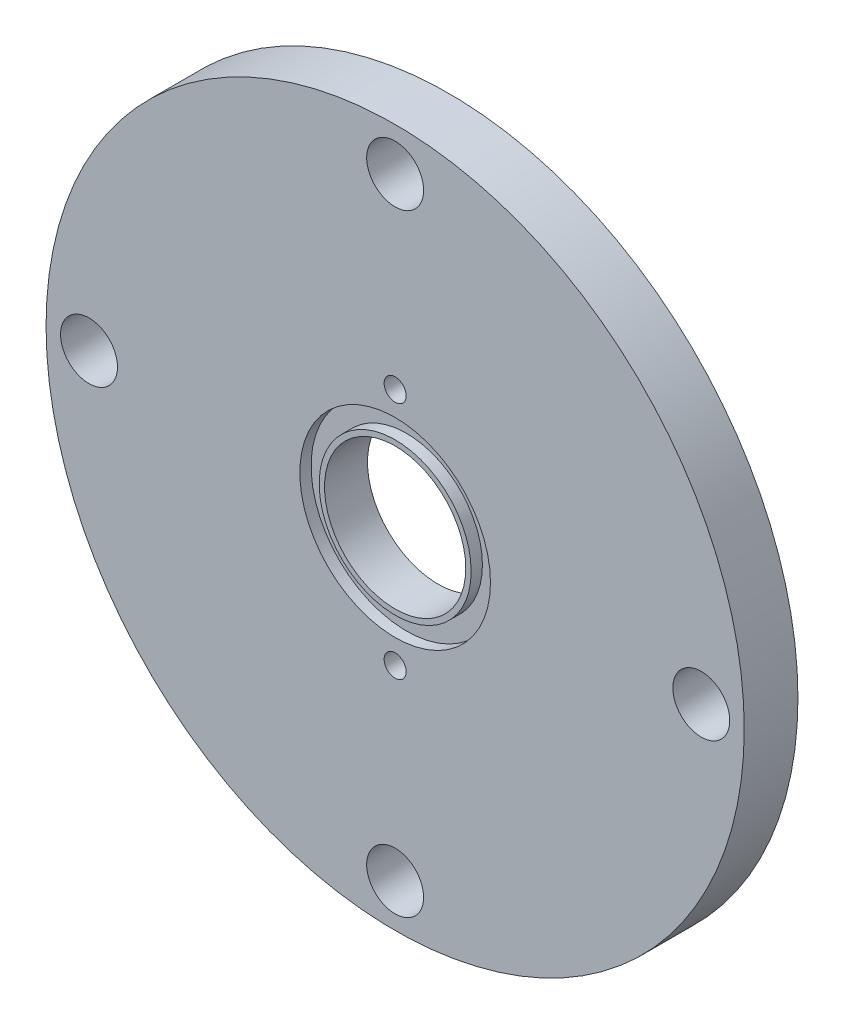
from build123d import *

# Parameters (mm, degrees)
BOSS_EXTRUDE1_START       = -4
BOSS_EXTRUDE1_OUTLINE_R   = 2.2
BOSS_EXTRUDE1_OUTLINE_R_2 = 1.025
BOSS_EXTRUDE1_OUTLINE_R_3 = 6.575
BOSS_EXTRUDE1_DEPTH       = 4
SKETCH3_R                 = 8.875
SKETCH3_R_2               = 7.075
CUT_EXTRUDE1_DEPTH        = 1.05
BOSS_EXTRUDE2_START       = -4
SKETCH4_R                 = 1.025
BOSS_EXTRUDE2_DEPTH       = 0.75
FILLET1_R                 = 1
BOSS_EXTRUDE3_START       = -5
SKETCH5_R                 = 32.5
SKETCH5_R_2               = 1.025
SKETCH5_R_3               = 8.875
BOSS_EXTRUDE3_DEPTH       = 5
SKETCH6_R                 = 2.65
CUT_EXTRUDE2_DEPTH        = 5
SKETCH7_R                 = 20.6
SKETCH7_R_2               = 15.6
CUT_EXTRUDE3_DEPTH        = 2.5
BOSS_EXTRUDE4_START       = 1
SKETCH8_R                 = 1.025
BOSS_EXTRUDE4_DEPTH       = 1


# Read off the part's stored shape, not the designer's step: Boss-Extrude1
with BuildPart() as part:
    # Boss-Extrude1 outline → Boss-Extrude1 (new body)
    with BuildSketch(Plane.XY.offset(BOSS_EXTRUDE1_START)):
        with BuildLine():
            Line((-5.8, 12.8), (-5.8, -12.8))
            ThreePointArc((-5.8, -12.8), (-1.992388155, -21.992388155), (7.2, -25.8))
            Line((7.2, -25.8), (32.8, -25.8))
            ThreePointArc((32.8, -25.8), (41.992388155, -21.992388155), (45.8, -12.8))
            Line((45.8, -12.8), (45.8, 12.8))
            ThreePointArc((45.8, 12.8), (41.992388155, 21.992388155), (32.8, 25.8))
            Line((32.8, 25.8), (7.2, 25.8))
            ThreePointArc((7.2, 25.8), (-1.992388155, 21.992388155), (-5.8, 12.8))
        make_face()
        with Locations((25, -22)):
            Circle(BOSS_EXTRUDE1_OUTLINE_R, mode=Mode.SUBTRACT)
        with Locations((20, -11.1252)):
            Circle(BOSS_EXTRUDE1_OUTLINE_R_2, mode=Mode.SUBTRACT)
        with Locations((-2, 0)):
            Circle(BOSS_EXTRUDE1_OUTLINE_R, mode=Mode.SUBTRACT)
        with Locations((20, 0)):
            Circle(BOSS_EXTRUDE1_OUTLINE_R_3, mode=Mode.SUBTRACT)
        with Locations((20, 11.1252)):
            Circle(BOSS_EXTRUDE1_OUTLINE_R_2, mode=Mode.SUBTRACT)
        with Locations((42, 0)):
            Circle(BOSS_EXTRUDE1_OUTLINE_R, mode=Mode.SUBTRACT)
        with Locations((25, 22)):
            Circle(BOSS_EXTRUDE1_OUTLINE_R, mode=Mode.SUBTRACT)
    extrude(amount=BOSS_EXTRUDE1_DEPTH)

    # Sketch3 → Cut-Extrude1 (cut)
    with BuildSketch(Plane.XY):
        with Locations((20, 0)):
            Circle(SKETCH3_R)
        with Locations((20, 0)):
            Circle(SKETCH3_R_2, mode=Mode.SUBTRACT)
    extrude(amount=-CUT_EXTRUDE1_DEPTH, mode=Mode.SUBTRACT)

    # Sketch4 → Boss-Extrude2 (add)
    with BuildSketch(Plane.XY.offset(BOSS_EXTRUDE2_START)):
        with Locations((20, 11.1252)):
            Circle(SKETCH4_R)
        with Locations((20, -11.1252)):
            Circle(SKETCH4_R)
    extrude(amount=BOSS_EXTRUDE2_DEPTH)

    # Fillet1
    fillet1_edges = [part.edges().sort_by_distance(p)[0] for p in [
        (18.975, 11.1252, -3.25),
        (18.975, -11.1252, -3.25),
    ]]
    fillet(fillet1_edges, radius=FILLET1_R)

    # Sketch5 → Boss-Extrude3 (add)
    with BuildSketch(Plane.XY.offset(BOSS_EXTRUDE3_START)):
        with Locations((20, 0)):
            Circle(SKETCH5_R)
        with Locations((20, -11.1252)):
            Circle(SKETCH5_R_2, mode=Mode.SUBTRACT)
        with Locations((20, 11.1252)):
            Circle(SKETCH5_R_2, mode=Mode.SUBTRACT)
        with Locations((20, 0)):
            Circle(SKETCH5_R_3, mode=Mode.SUBTRACT)
    extrude(amount=BOSS_EXTRUDE3_DEPTH)

    # Sketch6 → Cut-Extrude2 (cut)
    with BuildSketch(Plane.XY):
        with Locations((-8.5, 0)):
            Circle(SKETCH6_R)
        with Locations((20, 28.5)):
            Circle(SKETCH6_R)
        with Locations((48.5, 0)):
            Circle(SKETCH6_R)
        with Locations((20, -28.5)):
            Circle(SKETCH6_R)
    extrude(amount=-CUT_EXTRUDE2_DEPTH, mode=Mode.SUBTRACT)

    # Sketch7 → Cut-Extrude3 (cut)
    with BuildSketch(Plane(origin=(0, 0, -5), x_dir=(-1, 0, 0), z_dir=(0, 0, -1))):
        with Locations((-20, 0)):
            Circle(SKETCH7_R)
        with Locations((-20, 0)):
            Circle(SKETCH7_R_2, mode=Mode.SUBTRACT)
    extrude(amount=-CUT_EXTRUDE3_DEPTH, mode=Mode.SUBTRACT)

    # Sketch8 → Boss-Extrude4 (add)
    with BuildSketch(Plane(origin=(0, 0, -4), x_dir=(-1, 0, 0), z_dir=(0, 0, -1)).offset(BOSS_EXTRUDE4_START)):
        with Locations(Location((-20, -11.1252, 0), (0, 0, 180))):
            Circle(SKETCH8_R)
        with Locations(Location((-20, 11.1252, 0), (0, 0, 180))):
            Circle(SKETCH8_R)
    extrude(amount=-BOSS_EXTRUDE4_DEPTH)


solid = part.part
